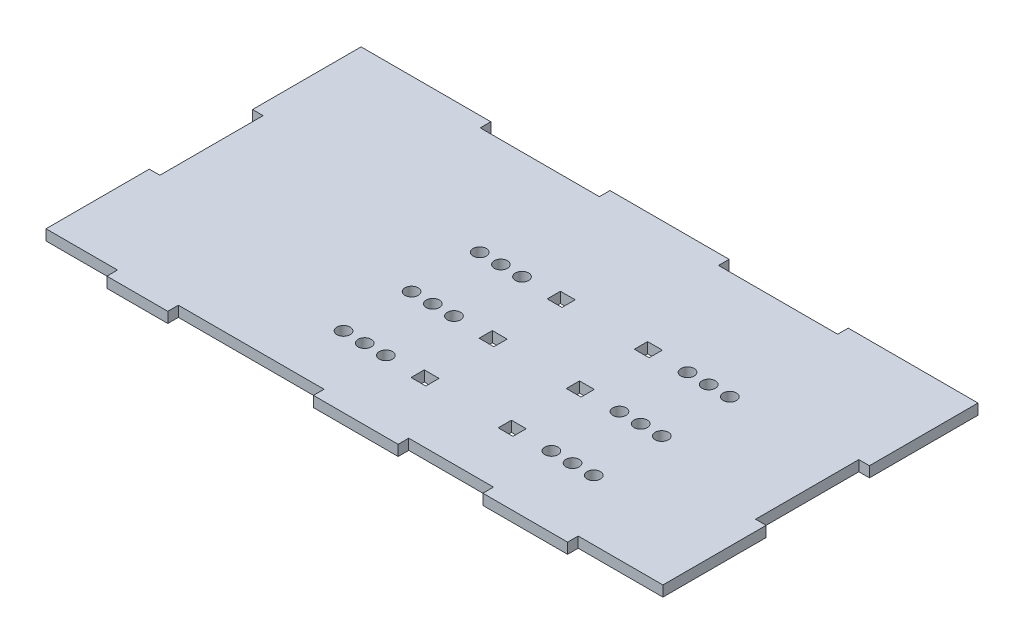
from build123d import *

# Parameters (mm, degrees)
SKETCH1_W           = 225
SKETCH1_H           = 115
BOSS_EXTRUDE1_DEPTH = 4
SKETCH3_W           = 5.58
SKETCH3_H           = 5
SKETCH3_R           = 2.5
CUT_EXTRUDE2_DEPTH  = 10
SKETCH4_W           = 4
SKETCH4_H           = 39
BOSS_EXTRUDE2_DEPTH = 4
SKETCH5_W           = 45
SKETCH5_H           = 4
BOSS_EXTRUDE3_DEPTH = 4
LPATTERN1_COUNT     = 2
LPATTERN1_PITCH     = 229
SKETCH6_W           = 23
SKETCH6_H           = 4
BOSS_EXTRUDE4_DEPTH = 4
SKETCH7_W           = 32
SKETCH7_H           = 4
BOSS_EXTRUDE5_DEPTH = 4
SKETCH8_W           = 4
SKETCH8_H           = 2
BOSS_EXTRUDE6_DEPTH = 4


with BuildPart() as part:
    # Sketch1 → Boss-Extrude1 (new body)
    with BuildSketch(Plane(origin=(0, 0, 0), x_dir=(1, 0, 0), z_dir=(0, 1, 0))):
        with Locations((112.5, 57.5)):
            Rectangle(SKETCH1_W, SKETCH1_H)
    extrude(amount=BOSS_EXTRUDE1_DEPTH)

    # Sketch3 → Cut-Extrude2 (cut)
    with BuildSketch(Plane(origin=(0, 4, 0), x_dir=(1, 0, 0), z_dir=(0, 1, 0))):
        with Locations((149.29999958, 74.2)):
            Rectangle(SKETCH3_W, SKETCH3_H)
        with Locations((116.37999958, 74.2)):
            Rectangle(SKETCH3_W, SKETCH3_H)
        with Locations((116.37999958, 48.49)):
            Rectangle(SKETCH3_W, SKETCH3_H)
        with Locations((116.37999958, 22.78)):
            Rectangle(SKETCH3_W, SKETCH3_H)
        with Locations((149.29999958, 48.49)):
            Rectangle(SKETCH3_W, SKETCH3_H)
        with Locations((149.29999958, 22.78)):
            Rectangle(SKETCH3_W, SKETCH3_H)
        with Locations((180.08999958, 74.2)):
            Circle(SKETCH3_R)
        with Locations((172.08999958, 74.2)):
            Circle(SKETCH3_R)
        with Locations((164.08999958, 74.2)):
            Circle(SKETCH3_R)
        with Locations((101.58999958, 74.2)):
            Circle(SKETCH3_R)
        with Locations((93.58999958, 74.2)):
            Circle(SKETCH3_R)
        with Locations((85.58999958, 74.2)):
            Circle(SKETCH3_R)
        with Locations((101.58999958, 48.49)):
            Circle(SKETCH3_R)
        with Locations((93.58999958, 48.49)):
            Circle(SKETCH3_R)
        with Locations((85.58999958, 48.49)):
            Circle(SKETCH3_R)
        with Locations((101.58999958, 22.78)):
            Circle(SKETCH3_R)
        with Locations((93.58999958, 22.78)):
            Circle(SKETCH3_R)
        with Locations((85.58999958, 22.78)):
            Circle(SKETCH3_R)
        with Locations((180.08999958, 48.49)):
            Circle(SKETCH3_R)
        with Locations((172.08999958, 48.49)):
            Circle(SKETCH3_R)
        with Locations((164.08999958, 48.49)):
            Circle(SKETCH3_R)
        with Locations((180.08999958, 22.78)):
            Circle(SKETCH3_R)
        with Locations((172.08999958, 22.78)):
            Circle(SKETCH3_R)
        with Locations((164.08999958, 22.78)):
            Circle(SKETCH3_R)
    extrude(amount=-CUT_EXTRUDE2_DEPTH, mode=Mode.SUBTRACT)

    # Sketch4 → Boss-Extrude2 (add)
    with BuildSketch(Plane(origin=(0, 4, 0), x_dir=(1, 0, 0), z_dir=(0, 1, 0))):
        with Locations((-2, 19.5)):
            Rectangle(SKETCH4_W, SKETCH4_H)
        with Locations((-2, 97.5)):
            Rectangle(SKETCH4_W, SKETCH4_H)
    boss_extrude2 = extrude(amount=-BOSS_EXTRUDE2_DEPTH)

    # Sketch5 → Boss-Extrude3 (add)
    with BuildSketch(Plane(origin=(0, 4, 0), x_dir=(1, 0, 0), z_dir=(0, 1, 0))):
        with Locations((112.5, 117)):
            Rectangle(SKETCH5_W, SKETCH5_H)
        with Locations((202.5, 117)):
            Rectangle(SKETCH5_W, SKETCH5_H)
        with Locations((22.5, 117)):
            Rectangle(SKETCH5_W, SKETCH5_H)
    extrude(amount=-BOSS_EXTRUDE3_DEPTH)

    # LPattern1: Boss-Extrude2 ×2
    with Locations(*[(i * LPATTERN1_PITCH, 0, 0) for i in range(1, LPATTERN1_COUNT)]):
        add(boss_extrude2)

    # Sketch6 → Boss-Extrude4 (add)
    with BuildSketch(Plane(origin=(0, 4, 0), x_dir=(1, 0, 0), z_dir=(0, 1, 0))):
        with Locations((34.5, -2)):
            Rectangle(SKETCH6_W, SKETCH6_H)
    extrude(amount=-BOSS_EXTRUDE4_DEPTH)

    # Sketch7 → Boss-Extrude5 (add)
    with BuildSketch(Plane(origin=(0, 4, 0), x_dir=(1, 0, 0), z_dir=(0, 1, 0))):
        with Locations((181, -2)):
            Rectangle(SKETCH7_W, SKETCH7_H)
        with Locations((117, -2)):
            Rectangle(SKETCH7_W, SKETCH7_H)
    extrude(amount=-BOSS_EXTRUDE5_DEPTH)

    # Sketch8 → Boss-Extrude6 (add)
    with BuildSketch(Plane(origin=(0, 4, 0), x_dir=(1, 0, 0), z_dir=(0, 1, 0))):
        with Locations((-2, 118)):
            Rectangle(SKETCH8_W, SKETCH8_H)
        with Locations((227, 118)):
            Rectangle(SKETCH8_W, SKETCH8_H)
    extrude(amount=-BOSS_EXTRUDE6_DEPTH)


solid = part.part
